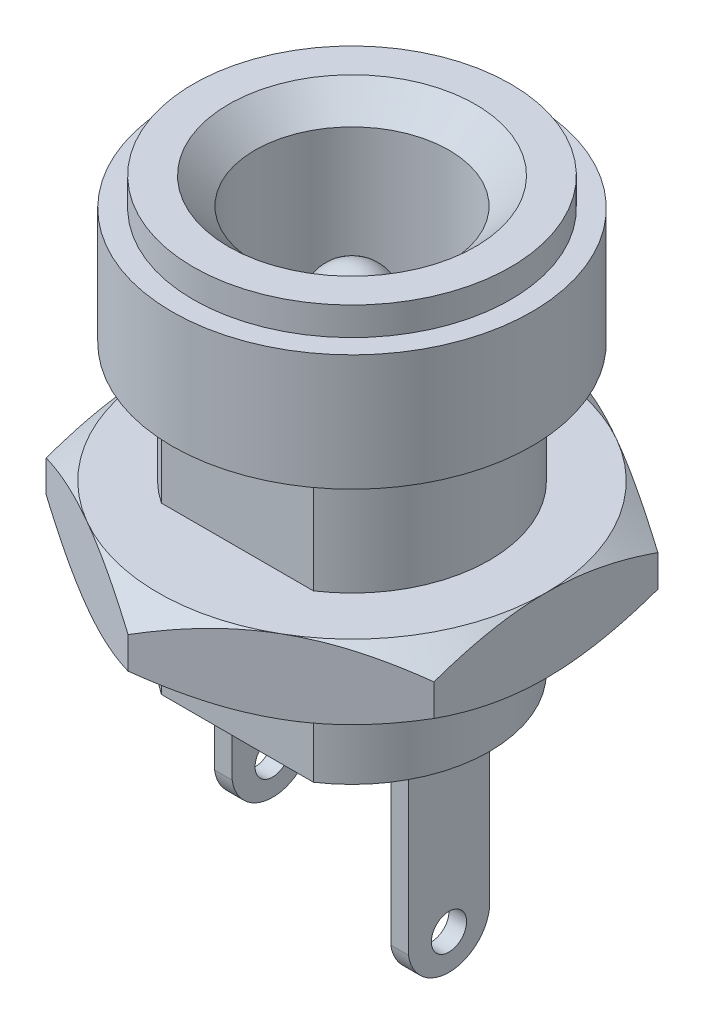
from build123d import *

# Parameters (mm, degrees)
SKETCH2_W              = 0.5
SKETCH2_H              = 2.3
BOSS_EXTRUDE1_DEPTH    = 6
CUT_EXTRUDE1_REACH     = 17.378
SKETCH3_W              = 2.3
SKETCH3_H              = 1.8
CUT_EXTRUDE2_START     = -0.5
CUT_EXTRUDE2_OUTLINE_R = 0.5
CUT_EXTRUDE2_DEPTH     = 0.5
CUT_EXTRUDE3_START     = -2.85
SKETCH5_R              = 0.5
CUT_EXTRUDE3_DEPTH     = 10.2
SKETCH6_W              = 10
SKETCH6_H              = 10
CUT_EXTRUDE4_DEPTH     = 8.1
BOSS_EXTRUDE2_DEPTH    = 2.1


# Read off the part's stored shape, not the designer's step: Cut-Extrude2
with BuildPart() as part:
    # Sketch1 → Revolve1 (revolve)
    with BuildSketch(Plane.XY, mode=Mode.PRIVATE) as revolve1_sk:
        with BuildLine():
            Line((3.9, 0), (3.9, 8.1))
            Line((3.9, 8.1), (5.1, 8.1))
            Line((5.1, 8.1), (5.1, 11.4))
            Line((5.1, 11.4), (4.5, 11.4))
            Line((4.5, 11.4), (4.5, 12.2))
            Line((4.5, 12.2), (3.5, 12.2))
            Line((3.5, 12.2), (2.75, 11.45))
            Line((2.75, 11.45), (2.75, 3.2))
            Line((2.75, 3.2), (1.05, 3.2))
            Line((1.05, 3.2), (1.05, 8.95))
            ThreePointArc((1.05, 8.95), (0.74246212, 9.69246212), (0, 10))
            Line((0, 10), (0, 2))
            Line((0, 2), (1.3, 2))
            Line((1.3, 2), (1.3, 0))
            Line((1.3, 0), (3.9, 0))
        make_face()
    revolve(revolve1_sk.sketch.rotate(Axis((0, 10, 0), (0, -1, 0)), 90), axis=Axis((0, 10, 0), (0, -1, 0)))

    # Sketch2 → Boss-Extrude1 (add)
    with BuildSketch(Plane.XZ):
        with Locations((2.5, 0)):
            Rectangle(SKETCH2_W, SKETCH2_H)
        with Locations((-2.5, 0)):
            Rectangle(SKETCH2_W, SKETCH2_H)
    extrude(amount=BOSS_EXTRUDE1_DEPTH)

    # Sketch3 → Cut-Extrude1 (cut, up to next)
    with BuildSketch(Plane.ZY.offset(2.75), mode=Mode.PRIVATE) as cut_extrude1_sk1:
        with Locations((0, -5.1)):
            Rectangle(SKETCH3_W, SKETCH3_H)
    cut_extrude1_tool1 = extrude(cut_extrude1_sk1.sketch, amount=-CUT_EXTRUDE1_REACH, mode=Mode.PRIVATE) & part.part
    add(cut_extrude1_tool1.solids().sort_by_distance((-2.75, -5.1, 0))[0], mode=Mode.SUBTRACT)

    # Cut-Extrude2 outline → Cut-Extrude2 (cut)
    with BuildSketch(Plane.ZY.offset(2.75).offset(CUT_EXTRUDE2_START)):
        with Locations((0, -3.2)):
            Circle(CUT_EXTRUDE2_OUTLINE_R)
        with BuildLine():
            ThreePointArc((1.15, -3.2), (0.761987533, -3.915035663), (0, -4.2))
            Line((0, -4.2), (1.15, -4.2))
            Line((1.15, -4.2), (1.15, -3.2))
        make_face()
        with BuildLine():
            ThreePointArc((0, -4.2), (-0.761987533, -3.915035663), (-1.15, -3.2))
            Line((-1.15, -3.2), (-1.15, -4.2))
            Line((-1.15, -4.2), (0, -4.2))
        make_face()
    extrude(amount=CUT_EXTRUDE2_DEPTH, mode=Mode.SUBTRACT)

    # Sketch5 → Cut-Extrude3 (cut)
    with BuildSketch(Plane.ZY.offset(-2.25).offset(CUT_EXTRUDE3_START)):
        with Locations((0, -5)):
            Circle(SKETCH5_R)
        with BuildLine():
            Line((-1.15, -5), (-1.15, -6.5))
            Line((-1.15, -6.5), (1.15, -6.5))
            Line((1.15, -6.5), (1.15, -5))
            ThreePointArc((1.15, -5), (0, -6), (-1.15, -5))
        make_face()
    extrude(amount=CUT_EXTRUDE3_DEPTH, mode=Mode.SUBTRACT)

    # Sketch6 → Cut-Extrude4 (cut)
    with BuildSketch(Plane.XZ):
        with Locations((0, 8.25)):
            Rectangle(SKETCH6_W, SKETCH6_H)
        with Locations((0, -8.25)):
            Rectangle(SKETCH6_W, SKETCH6_H)
    extrude(amount=-CUT_EXTRUDE4_DEPTH, mode=Mode.SUBTRACT)

    # Sketch7 → Boss-Extrude2 (add)
    with BuildSketch(Plane(origin=(0, 4.7, 0), x_dir=(-1, 0, 0), z_dir=(0, -1, 0))):
        Polygon((0, 6.350852961), (-5.5, 3.175426481), (-5.5, -3.175426481), (0, -6.350852961), (5.5, -3.175426481), (5.5, 3.175426481), align=None)
    extrude(amount=BOSS_EXTRUDE2_DEPTH)

    # Sketch9 → Cut-Revolve1 (revolve, cut)
    with BuildSketch(Plane(origin=(0, 0, 0), x_dir=(0, 0, -1), z_dir=(1, 0, 0)), mode=Mode.PRIVATE) as cut_revolve1_sk:
        Polygon((6.350852961, 4.1), (5.5, 4.7), (8.5, 4.7), (8.5, 2.6), (5.5, 2.6), (6.350852961, 3.2), align=None)
    revolve(cut_revolve1_sk.sketch.rotate(Axis((0, 0, 0), (0, 1, 0)), 270), axis=Axis((0, 0, 0), (0, 1, 0)), mode=Mode.SUBTRACT)


solid = part.part
